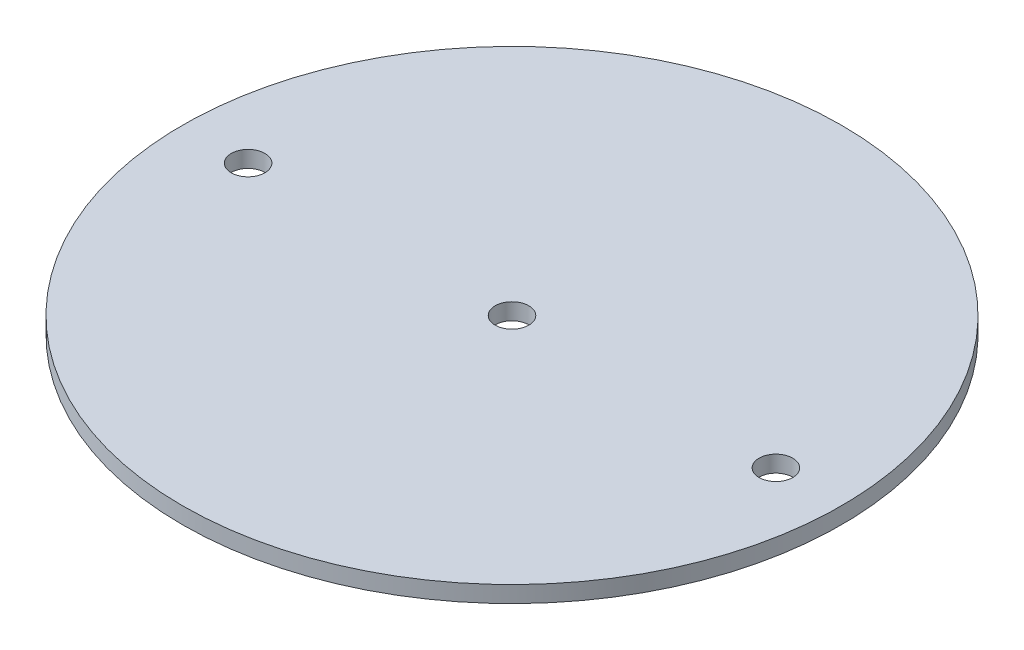
from build123d import *

# Parameters (mm, degrees)
SKETCH2_R           = 63.4365
SKETCH2_R_2         = 3.2385
BOSS_EXTRUDE1_DEPTH = 3.175


with BuildPart() as part:
    # Sketch2 → Boss-Extrude1 (new body)
    with BuildSketch(Plane(origin=(0, 0, 0), x_dir=(1, 0, 0), z_dir=(0, 1, 0))):
        Circle(SKETCH2_R)
        with Locations((-50.8, 0)):
            Circle(SKETCH2_R_2, mode=Mode.SUBTRACT)
        with Locations((50.8, 0)):
            Circle(SKETCH2_R_2, mode=Mode.SUBTRACT)
        Circle(SKETCH2_R_2, mode=Mode.SUBTRACT)
    extrude(amount=BOSS_EXTRUDE1_DEPTH)


solid = part.part
